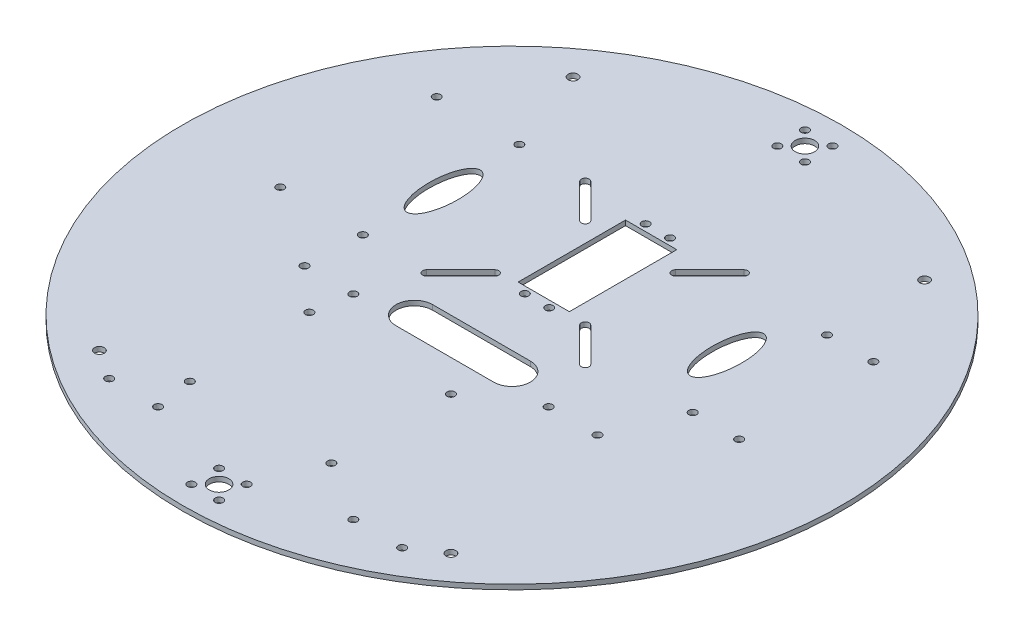
from build123d import *

# Parameters (mm, degrees)
SKETCH_1_R          = 135
EXTRUDE_1_DEPTH     = 2
SKETCH_563_R        = 1.6
SKETCH_563_W        = 21
SKETCH_563_H        = 44
CUT_EXTRUDE_1_DEPTH = 10
SKETCH_1032_R       = 1.6
CUT_EXTRUDE_2_DEPTH = 10
SKETCH_4_R          = 2
SKETCH_4_R_2        = 4
SKETCH_4_R_3        = 1.6
CUT_EXTRUDE_3_DEPTH = 10
CUT_EXTRUDE_4_DEPTH = 10
SKETCH_6_R          = 1.6
SKETCH_6_RX         = 15
SKETCH_6_RY         = 6
CUT_EXTRUDE_7_DEPTH = 10


with BuildPart() as part:
    # 草图1 → 凸台-拉伸1 (new body)
    with BuildSketch(Plane(origin=(0, 0, 0), x_dir=(1, 0, 0), z_dir=(0, 1, 0))):
        Circle(SKETCH_1_R)
    extrude(amount=EXTRUDE_1_DEPTH)

    # Sketch 563 → 切除-拉伸1 (cut)
    with BuildSketch(Plane(origin=(0, 2, 0), x_dir=(1, 0, 0), z_dir=(0, 1, 0))):
        with Locations((-5, 59.75)):
            Circle(SKETCH_563_R)
        with Locations((5, 59.75)):
            Circle(SKETCH_563_R)
        with Locations((-5, 10.25)):
            Circle(SKETCH_563_R)
        with Locations((5, 10.25)):
            Circle(SKETCH_563_R)
        with Locations((18.5, 48.5)):
            Circle(SKETCH_563_R)
        with Locations((18.5, 11.5)):
            Circle(SKETCH_563_R)
        with Locations((-18.5, 11.5)):
            Circle(SKETCH_563_R)
        with Locations((-18.5, 48.5)):
            Circle(SKETCH_563_R)
        with Locations((0, 35)):
            Rectangle(SKETCH_563_W, SKETCH_563_H)
    extrude(amount=-CUT_EXTRUDE_1_DEPTH, mode=Mode.SUBTRACT)

    # Sketch 1032 → 切除-拉伸2 (cut)
    with BuildSketch(Plane(origin=(0, 2, 0), x_dir=(1, 0, 0), z_dir=(0, 1, 0))):
        with Locations((-60, -25)):
            Circle(SKETCH_1032_R)
        with Locations((-40, -25)):
            Circle(SKETCH_1032_R)
        with Locations((40, -25)):
            Circle(SKETCH_1032_R)
        with Locations((60, -25)):
            Circle(SKETCH_1032_R)
        with Locations((60, -105)):
            Circle(SKETCH_1032_R)
        with Locations((40, -105)):
            Circle(SKETCH_1032_R)
        with Locations((-40, -105)):
            Circle(SKETCH_1032_R)
        with Locations((-60, -105)):
            Circle(SKETCH_1032_R)
        with Locations((-42.5, -89.5)):
            Circle(SKETCH_1032_R)
        with Locations((-42.5, -40.5)):
            Circle(SKETCH_1032_R)
        with Locations((15.5, -40.5)):
            Circle(SKETCH_1032_R)
        with Locations((15.5, -89.5)):
            Circle(SKETCH_1032_R)
    extrude(amount=-CUT_EXTRUDE_2_DEPTH, mode=Mode.SUBTRACT)

    # 草图4 → 切除-拉伸3 (cut)
    with BuildSketch(Plane(origin=(0, 2, 0), x_dir=(1, 0, 0), z_dir=(0, 1, 0))):
        with Locations((-72, 97)):
            Circle(SKETCH_4_R)
        with Locations((72, 97)):
            Circle(SKETCH_4_R)
        with Locations((72, -97)):
            Circle(SKETCH_4_R)
        with Locations((-72, -97)):
            Circle(SKETCH_4_R)
        with Locations((0, -120)):
            Circle(SKETCH_4_R_2)
        with Locations((-5.656854249, -125.656854249)):
            Circle(SKETCH_4_R_3)
        with Locations((-5.656854249, -114.343145751)):
            Circle(SKETCH_4_R_3)
        with Locations((5.656854249, -114.343145751)):
            Circle(SKETCH_4_R_3)
        with Locations((5.656854249, -125.656854249)):
            Circle(SKETCH_4_R_3)
        with Locations((5.656854249, 125.656854249)):
            Circle(SKETCH_4_R_3)
        with Locations((5.656854249, 114.343145751)):
            Circle(SKETCH_4_R_3)
        with Locations((-5.656854249, 114.343145751)):
            Circle(SKETCH_4_R_3)
        with Locations((-5.656854249, 125.656854249)):
            Circle(SKETCH_4_R_3)
        with Locations((0, 120)):
            Circle(SKETCH_4_R_2)
        with BuildLine():
            Line((-20, -12.5), (20, -12.5))
            ThreePointArc((20, -12.5), (27.5, -20), (20, -27.5))
            Line((20, -27.5), (-20, -27.5))
            ThreePointArc((-20, -27.5), (-27.5, -20), (-20, -12.5))
        make_face()
    extrude(amount=-CUT_EXTRUDE_3_DEPTH, mode=Mode.SUBTRACT)

    # 草图5 → 切除-拉伸4 (cut)
    with BuildSketch(Plane(origin=(0, 2, 0), x_dir=(1, 0, 0), z_dir=(0, 1, 0))):
        with BuildLine():
            Line((-31.36862915, 63.63137085), (-17.36862915, 49.63137085))
            ThreePointArc((-17.36862915, 49.63137085), (-17.36862915, 47.36862915), (-19.63137085, 47.36862915))
            Line((-19.63137085, 47.36862915), (-33.63137085, 61.36862915))
            ThreePointArc((-33.63137085, 61.36862915), (-33.63137085, 63.63137085), (-31.36862915, 63.63137085))
        make_face()
        with BuildLine():
            Line((33.63137085, 61.36862915), (19.63137085, 47.36862915))
            ThreePointArc((19.63137085, 47.36862915), (17.36862915, 47.36862915), (17.36862915, 49.63137085))
            Line((17.36862915, 49.63137085), (31.36862915, 63.63137085))
            ThreePointArc((31.36862915, 63.63137085), (33.63137085, 63.63137085), (33.63137085, 61.36862915))
        make_face()
        with BuildLine():
            Line((31.36862915, -3.63137085), (17.36862915, 10.36862915))
            ThreePointArc((17.36862915, 10.36862915), (17.36862915, 12.63137085), (19.63137085, 12.63137085))
            Line((19.63137085, 12.63137085), (33.63137085, -1.36862915))
            ThreePointArc((33.63137085, -1.36862915), (33.63137085, -3.63137085), (31.36862915, -3.63137085))
        make_face()
        with BuildLine():
            Line((-33.63137085, -1.36862915), (-19.63137085, 12.63137085))
            ThreePointArc((-19.63137085, 12.63137085), (-17.36862915, 12.63137085), (-17.36862915, 10.36862915))
            Line((-17.36862915, 10.36862915), (-31.36862915, -3.63137085))
            ThreePointArc((-31.36862915, -3.63137085), (-33.63137085, -3.63137085), (-33.63137085, -1.36862915))
        make_face()
    extrude(amount=-CUT_EXTRUDE_4_DEPTH, mode=Mode.SUBTRACT)

    # 草图6 → 切除-拉伸7 (cut)
    with BuildSketch(Plane(origin=(0, 2, 0), x_dir=(1, 0, 0), z_dir=(0, 1, 0))):
        with Locations((71.537199543, 2.5)):
            Circle(SKETCH_6_R)
        with Locations((90.537199543, 2.5)):
            Circle(SKETCH_6_R)
        with Locations((90.537199543, 57.5)):
            Circle(SKETCH_6_R)
        with Locations((71.537199543, 57.5)):
            Circle(SKETCH_6_R)
        with Locations((-92.885957975, -2.05)):
            Circle(SKETCH_6_R)
        with Locations((-59.045957975, -2.05)):
            Circle(SKETCH_6_R)
        with Locations((-92.885957975, 62.05)):
            Circle(SKETCH_6_R)
        with Locations((-59.045957975, 62.05)):
            Circle(SKETCH_6_R)
        with Locations(Location((-58.031053316, 30), (0, 0, -90))):
            Ellipse(SKETCH_6_RX, SKETCH_6_RY)
        with Locations(Location((58.031053316, 30), (0, 0, 90))):
            Ellipse(SKETCH_6_RX, SKETCH_6_RY)
    extrude(amount=-CUT_EXTRUDE_7_DEPTH, mode=Mode.SUBTRACT)


solid = part.part
